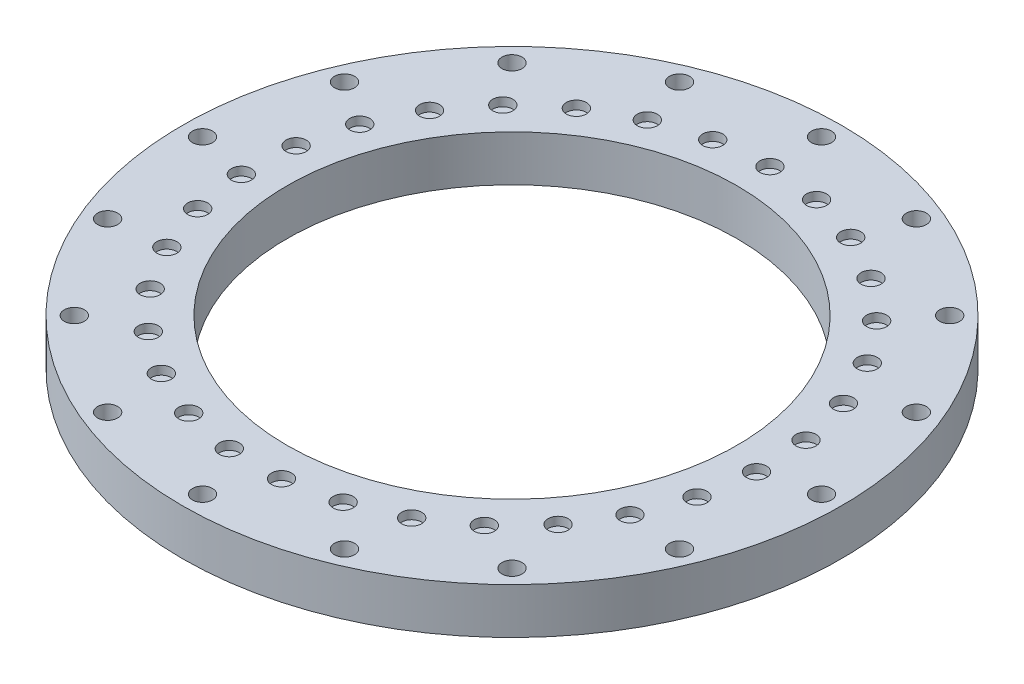
from build123d import *

# Parameters (mm, degrees)
SKETCH1_R           = 57.5
SKETCH1_R_2         = 39.25
BOSS_EXTRUDE1_DEPTH = 8
SKETCH2_R           = 1.75
CUT_EXTRUDE1_DEPTH  = 17
SKETCH3_R           = 1.75
CUT_EXTRUDE2_DEPTH  = 1.5
SKETCH5_R           = 2
CUT_EXTRUDE3_DEPTH  = 5


with BuildPart() as part:
    # Sketch1 → Boss-Extrude1 (new body)
    with BuildSketch(Plane(origin=(0, 0, 0), x_dir=(1, 0, 0), z_dir=(0, 1, 0))):
        Circle(SKETCH1_R)
        Circle(SKETCH1_R_2, mode=Mode.SUBTRACT)
    extrude(amount=BOSS_EXTRUDE1_DEPTH)

    # Sketch2 → Cut-Extrude1 (cut)
    with BuildSketch(Plane(origin=(0, 8, 0), x_dir=(1, 0, 0), z_dir=(0, 1, 0))):
        with Locations((0, 54)):
            Circle(SKETCH2_R)
        with Locations((20.664905348, 49.889494756)):
            Circle(SKETCH2_R)
        with Locations((38.183766184, 38.183766184)):
            Circle(SKETCH2_R)
        with Locations((49.889494756, 20.664905348)):
            Circle(SKETCH2_R)
        with Locations((54, 0)):
            Circle(SKETCH2_R)
        with Locations((49.889494756, -20.664905348)):
            Circle(SKETCH2_R)
        with Locations((38.183766184, -38.183766184)):
            Circle(SKETCH2_R)
        with Locations((20.664905348, -49.889494756)):
            Circle(SKETCH2_R)
        with Locations((0, -54)):
            Circle(SKETCH2_R)
        with Locations((-20.664905348, -49.889494756)):
            Circle(SKETCH2_R)
        with Locations((-38.183766184, -38.183766184)):
            Circle(SKETCH2_R)
        with Locations((-49.889494756, -20.664905348)):
            Circle(SKETCH2_R)
        with Locations((-54, 0)):
            Circle(SKETCH2_R)
        with Locations((-49.889494756, 20.664905348)):
            Circle(SKETCH2_R)
        with Locations((-38.183766184, 38.183766184)):
            Circle(SKETCH2_R)
        with Locations((-20.664905348, 49.889494756)):
            Circle(SKETCH2_R)
    extrude(amount=-CUT_EXTRUDE1_DEPTH, mode=Mode.SUBTRACT)

    # Sketch3 → Cut-Extrude2 (cut)
    with BuildSketch(Plane(origin=(0, 8, 0), x_dir=(1, 0, 0), z_dir=(0, 1, 0))):
        with Locations((0, 45)):
            Circle(SKETCH3_R)
        with Locations((9.058433404, 44.078847356)):
            Circle(SKETCH3_R)
        with Locations((17.74601348, 41.353101523)):
            Circle(SKETCH3_R)
        with Locations((25.707069679, 36.934354854)):
            Circle(SKETCH3_R)
        with Locations((32.615675425, 31.003511358)):
            Circle(SKETCH3_R)
        with Locations((38.188991587, 23.803380465)):
            Circle(SKETCH3_R)
        with Locations((42.198845947, 15.628736378)):
            Circle(SKETCH3_R)
        with Locations((44.481074595, 6.814249988)):
            Circle(SKETCH3_R)
        with Locations((44.942242823, -2.279212598)):
            Circle(SKETCH3_R)
        with Locations((43.563470349, -11.279363952)):
            Circle(SKETCH3_R)
        with Locations((40.401204281, -19.81773682)):
            Circle(SKETCH3_R)
        with Locations((35.584908162, -27.544769215)):
            Circle(SKETCH3_R)
        with Locations((29.311761723, -34.144115521)):
            Circle(SKETCH3_R)
        with Locations((21.838588314, -39.345597727)):
            Circle(SKETCH3_R)
        with Locations((13.471340534, -42.936266538)):
            Circle(SKETCH3_R)
        with Locations((4.552574489, -44.769119553)):
            Circle(SKETCH3_R)
        with Locations((-4.552574489, -44.769119553)):
            Circle(SKETCH3_R)
        with Locations((-13.471340534, -42.936266538)):
            Circle(SKETCH3_R)
        with Locations((-21.838588314, -39.345597727)):
            Circle(SKETCH3_R)
        with Locations((-29.311761722, -34.144115521)):
            Circle(SKETCH3_R)
        with Locations((-35.584908162, -27.544769215)):
            Circle(SKETCH3_R)
        with Locations((-40.401204281, -19.81773682)):
            Circle(SKETCH3_R)
        with Locations((-43.563470349, -11.279363952)):
            Circle(SKETCH3_R)
        with Locations((-44.942242823, -2.279212598)):
            Circle(SKETCH3_R)
        with Locations((-44.481074595, 6.814249988)):
            Circle(SKETCH3_R)
        with Locations((-42.198845947, 15.628736378)):
            Circle(SKETCH3_R)
        with Locations((-38.188991587, 23.803380465)):
            Circle(SKETCH3_R)
        with Locations((-32.615675425, 31.003511358)):
            Circle(SKETCH3_R)
        with Locations((-25.707069679, 36.934354854)):
            Circle(SKETCH3_R)
        with Locations((-17.74601348, 41.353101523)):
            Circle(SKETCH3_R)
        with Locations((-9.058433404, 44.078847356)):
            Circle(SKETCH3_R)
    extrude(amount=-CUT_EXTRUDE2_DEPTH, mode=Mode.SUBTRACT)

    # Sketch5 → Cut-Extrude3 (cut)
    with BuildSketch(Plane.XZ):
        with Locations((0, 45)):
            Circle(SKETCH5_R)
        with Locations((38.97114317, -22.5)):
            Circle(SKETCH5_R)
        with Locations((-38.97114317, -22.5)):
            Circle(SKETCH5_R)
    extrude(amount=-CUT_EXTRUDE3_DEPTH, mode=Mode.SUBTRACT)


solid = part.part
